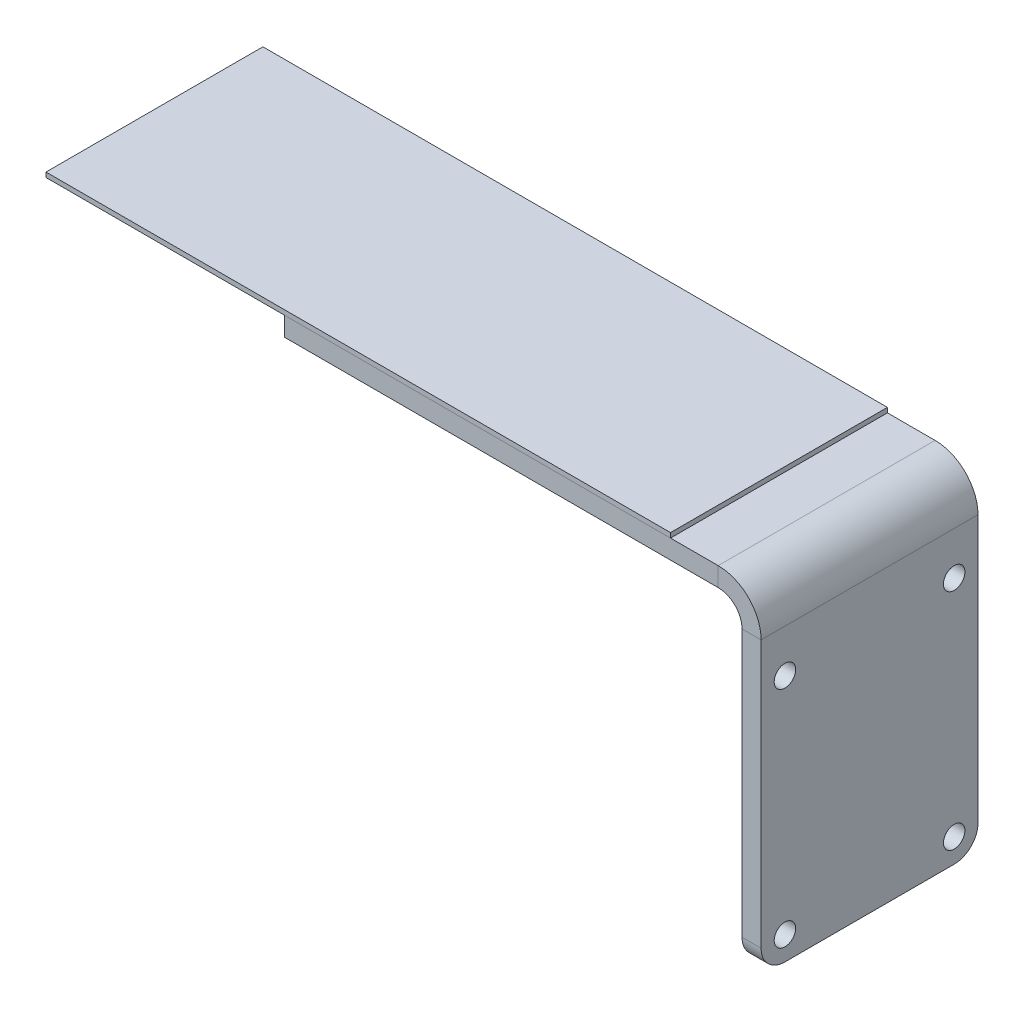
from build123d import *

# Parameters (mm, degrees)
SKETCH1_W                    = 45.5
SKETCH1_H                    = 70
SKETCH1_R                    = 2.25
BASE_FLANGE1_DEPTH           = 4
EDGE_FLANGE1_STRIP_W         = 26
EDGE_FLANGE1_STRIP_H         = 4
EDGE_FLANGE1_STRIP_CUT_DEPTH = 45.5
EDGE_FLANGE1_DEPTH           = 45.5
SKETCH9_W                    = 131
SKETCH9_H                    = 45.5
BOSS_EXTRUDE1_DEPTH          = 1
FILLET1_R                    = 5


# Sheet-metal steps are written as plain solids
with BuildPart() as part:
    # Sketch1 → Base-Flange1 (new body)
    with BuildSketch(Plane(origin=(0, 0, 0), x_dir=(0, 0, -1), z_dir=(1, 0, 0))):
        Rectangle(SKETCH1_W, SKETCH1_H)
        with Locations((-17.75, -30)):
            Circle(SKETCH1_R, mode=Mode.SUBTRACT)
        with Locations((17.75, -30)):
            Circle(SKETCH1_R, mode=Mode.SUBTRACT)
        with Locations((17.75, 17)):
            Circle(SKETCH1_R, mode=Mode.SUBTRACT)
        with Locations((-17.75, 17)):
            Circle(SKETCH1_R, mode=Mode.SUBTRACT)
    extrude(amount=-BASE_FLANGE1_DEPTH)

    # Edge-Flange1 strip (across the edge) → Edge-Flange1 strip cut (cut)
    with BuildSketch(Plane(origin=(-4, 35, 22.75), x_dir=(0, -1, 0), z_dir=(0, 0, -1))):
        with Locations((-4, -2)):
            Rectangle(EDGE_FLANGE1_STRIP_W, EDGE_FLANGE1_STRIP_H)
    extrude(amount=EDGE_FLANGE1_STRIP_CUT_DEPTH, mode=Mode.SUBTRACT)

    # Edge-Flange1 section (across the edge) → Edge-Flange1 (add)
    with BuildSketch(Plane(origin=(-4, 35, 22.75), x_dir=(0, -1, 0), z_dir=(0, 0, -1))):
        with BuildLine():
            Line((0, 5), (0, 96))
            Line((0, 96), (4, 96))
            Line((4, 96), (4, 5))
            ThreePointArc((4, 5), (5.464466094, 1.464466094), (9, 0))
            Line((9, 0), (9, -4))
            ThreePointArc((9, -4), (2.636038969, -1.363961031), (0, 5))
        make_face()
    extrude(amount=EDGE_FLANGE1_DEPTH)

    # Fillet1
    fillet1_edges = [part.edges().sort_by_distance(p)[0] for p in [
        (-2, -35, -22.75),
        (-2, -35, 22.75),
    ]]
    fillet(fillet1_edges, radius=FILLET1_R)


with BuildPart() as body_2:
    # Sketch9 → Boss-Extrude1 (new body)
    with BuildSketch(Plane(origin=(0, 35, 0), x_dir=(1, 0, 0), z_dir=(0, 1, 0))):
        with Locations((-84.5, 0)):
            Rectangle(SKETCH9_W, SKETCH9_H)
    extrude(amount=BOSS_EXTRUDE1_DEPTH)


solid = Compound([part.part, body_2.part])
